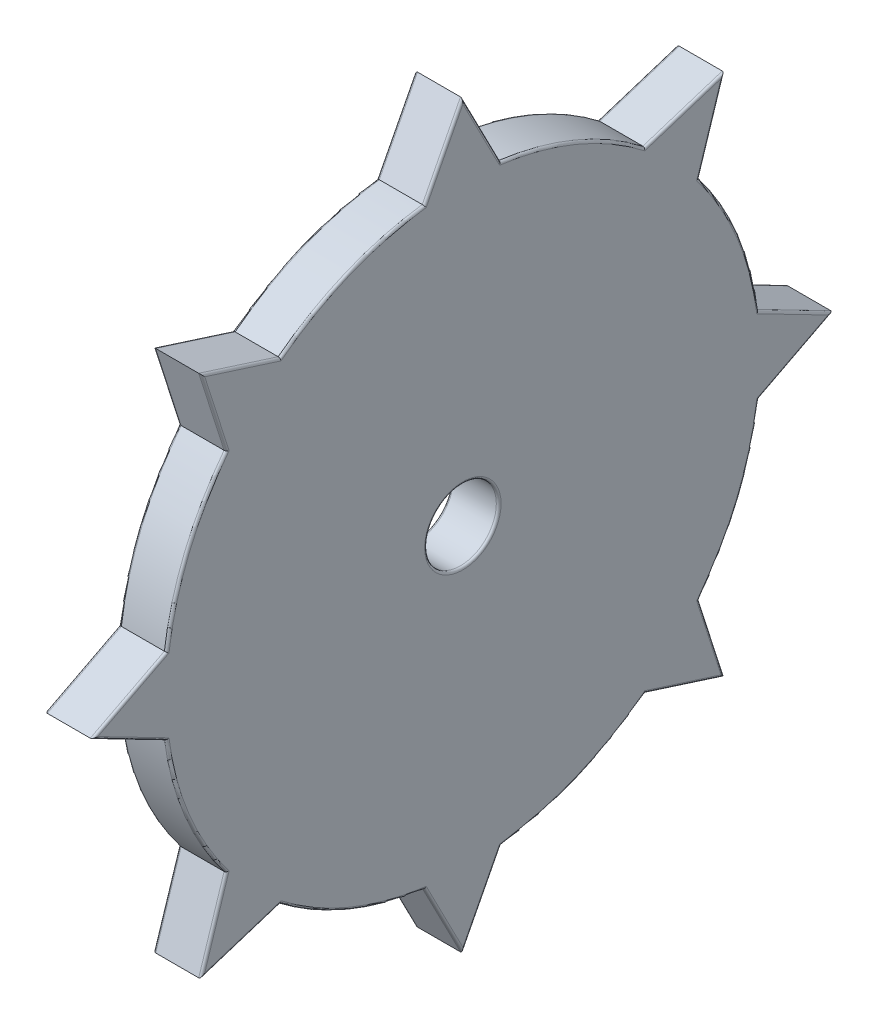
from build123d import *

# Parameters (mm, degrees)
SKETCH1_R           = 125
BOSS_EXTRUDE1_DEPTH = 20
BOSS_EXTRUDE3_START = -20
BOSS_EXTRUDE3_DEPTH = 20
SKETCH3_R           = 15
CUT_EXTRUDE1_DEPTH  = 20
FILLET1_R           = 1
FILLET3_R           = 1


# Read off the part's stored shape, not the designer's step: Boss-Extrude3
with BuildPart() as part:
    # Sketch1 → Boss-Extrude1 (new body)
    with BuildSketch(Plane(origin=(0, 0, 0), x_dir=(0, 0, -1), z_dir=(1, 0, 0))):
        Circle(SKETCH1_R)
    extrude(amount=BOSS_EXTRUDE1_DEPTH)

    # Boss-Extrude3 outline → Boss-Extrude3 (add)
    with BuildSketch(Plane.ZY.offset(BOSS_EXTRUDE3_START)):
        with BuildLine():
            Line((16, 123.97177098), (0, 155))
            Line((0, 155), (-16, 123.97177098))
            ThreePointArc((-16, 123.97177098), (0, 125), (16, 123.97177098))
        make_face()
        with BuildLine():
            ThreePointArc((-98.974988435, 76.347571437), (-88.388347648, 88.388347648), (-76.347571437, 98.974988435))
            Line((-76.347571437, 98.974988435), (-109.601551084, 109.601551084))
            Line((-109.601551084, 109.601551084), (-98.974988435, 76.347571437))
        make_face()
        with BuildLine():
            Line((109.601551084, 109.601551084), (76.347571437, 98.974988435))
            ThreePointArc((76.347571437, 98.974988435), (88.388347648, 88.388347648), (98.974988435, 76.347571437))
            Line((98.974988435, 76.347571437), (109.601551084, 109.601551084))
        make_face()
        with BuildLine():
            ThreePointArc((-123.97177098, -16), (-125, 0), (-123.97177098, 16))
            Line((-123.97177098, 16), (-155, 0))
            Line((-155, 0), (-123.97177098, -16))
        make_face()
        with BuildLine():
            Line((155, 0), (123.97177098, 16))
            ThreePointArc((123.97177098, 16), (125, 0), (123.97177098, -16))
            Line((123.97177098, -16), (155, 0))
        make_face()
        with BuildLine():
            ThreePointArc((-76.347571437, -98.974988435), (-88.388347648, -88.388347648), (-98.974988435, -76.347571437))
            Line((-98.974988435, -76.347571437), (-109.601551084, -109.601551084))
            Line((-109.601551084, -109.601551084), (-76.347571437, -98.974988435))
        make_face()
        with BuildLine():
            Line((109.601551084, -109.601551084), (98.974988435, -76.347571437))
            ThreePointArc((98.974988435, -76.347571437), (88.388347648, -88.388347648), (76.347571437, -98.974988435))
            Line((76.347571437, -98.974988435), (109.601551084, -109.601551084))
        make_face()
        with BuildLine():
            ThreePointArc((16, -123.97177098), (0, -125), (-16, -123.97177098))
            Line((-16, -123.97177098), (0, -155))
            Line((0, -155), (16, -123.97177098))
        make_face()
    extrude(amount=BOSS_EXTRUDE3_DEPTH)

    # Sketch3 → Cut-Extrude1 (cut)
    with BuildSketch(Plane(origin=(20, 0, 0), x_dir=(0, 0, -1), z_dir=(1, 0, 0))):
        Circle(SKETCH3_R)
    extrude(amount=-CUT_EXTRUDE1_DEPTH, mode=Mode.SUBTRACT)

    # Fillet1
    fillet1_edges = [part.edges().sort_by_distance(p)[0] for p in [
        (20, 0, 15),
        (20, 115.484941564, 47.835429046),
        (20, 139.48588549, 8),
        (20, 139.48588549, -8),
        (20, 115.484941564, -47.835429046),
        (20, 8, -139.48588549),
        (20, -8, -139.48588549),
        (20, -47.835429046, -115.484941564),
        (20, -92.97456126, -104.288269759),
        (20, -104.288269759, -92.97456126),
        (20, -115.484941564, -47.835429046),
        (20, -139.48588549, -8),
        (20, -139.48588549, 8),
        (20, -115.484941564, 47.835429046),
        (20, -104.288269759, 92.97456126),
        (20, -92.97456126, 104.288269759),
        (20, -47.835429046, 115.484941564),
        (20, -8, 139.48588549),
        (20, 8, 139.48588549),
        (20, 47.835429046, 115.484941564),
        (20, 92.97456126, 104.288269759),
        (20, 104.288269759, 92.97456126),
        (20, 104.288269759, -92.97456126),
        (20, 92.97456126, -104.288269759),
        (20, 47.835429046, -115.484941564),
    ]]
    fillet(fillet1_edges, radius=FILLET1_R)

    # Fillet3
    fillet3_edges = [part.edges().sort_by_distance(p)[0] for p in [
        (0, -139.48588549, 8),
        (0, -139.48588549, -8),
        (0, -47.835429046, -115.484941564),
        (0, -104.288269759, -92.97456126),
        (0, -92.97456126, -104.288269759),
        (0, 139.48588549, -8),
        (0, 47.835429046, -115.484941564),
        (0, 139.48588549, 8),
        (0, 8, -139.48588549),
        (0, -8, -139.48588549),
        (0, 115.484941564, -47.835429046),
        (0, 92.97456126, -104.288269759),
        (0, 104.288269759, -92.97456126),
        (0, 0, 15),
        (0, 47.835429046, 115.484941564),
        (0, 104.288269759, 92.97456126),
        (0, 92.97456126, 104.288269759),
        (0, -47.835429046, 115.484941564),
        (0, 115.484941564, 47.835429046),
        (0, 8, 139.48588549),
        (0, -8, 139.48588549),
        (0, -115.484941564, 47.835429046),
        (0, -92.97456126, 104.288269759),
        (0, -104.288269759, 92.97456126),
        (0, -115.484941564, -47.835429046),
    ]]
    fillet(fillet3_edges, radius=FILLET3_R)


solid = part.part
